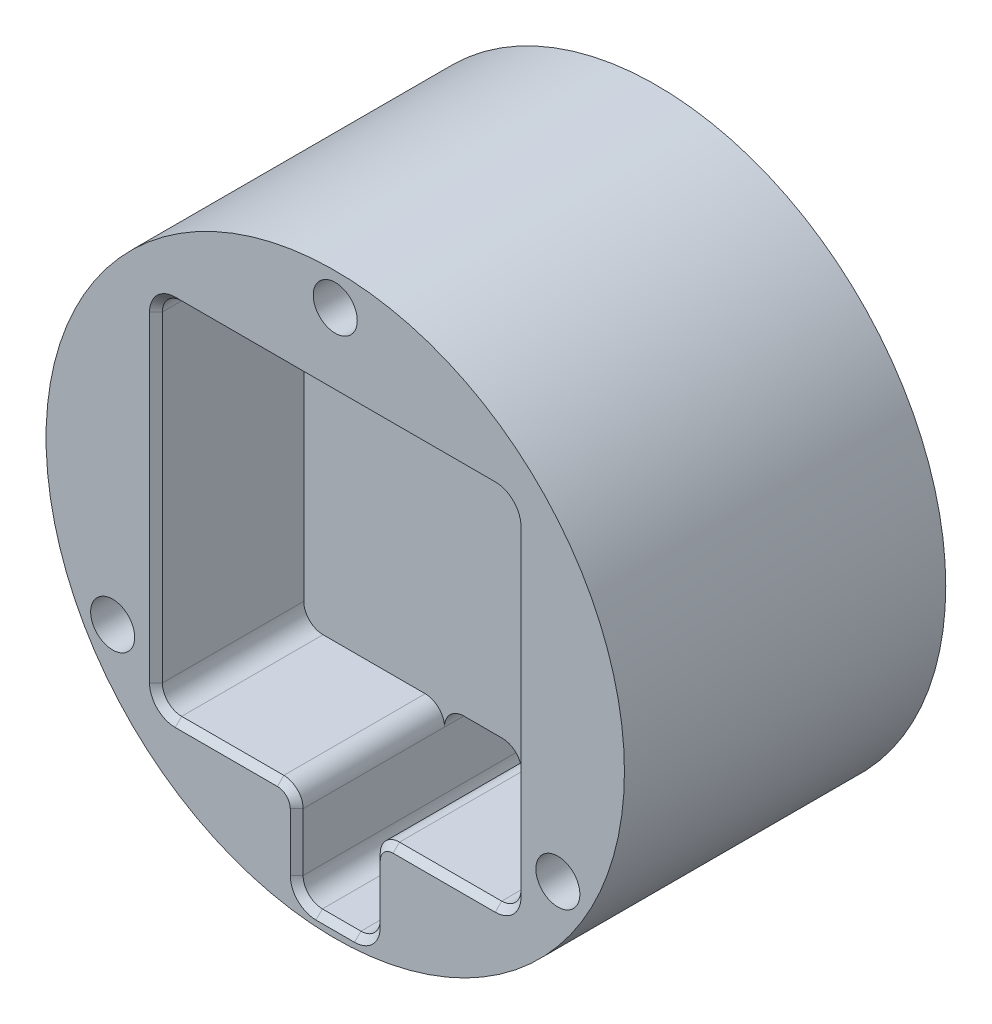
from build123d import *

# Parameters (mm, degrees)
ESQUISSE1_R             = 45
BOSS_EXTRU_1_DEPTH      = 50
ESQUISSE2_W             = 55.8
ESQUISSE2_H             = 56
ENL_V_MAT_EXTRU_1_DEPTH = 23
CONG_1_R                = 3
ESQUISSE3_W             = 12
ESQUISSE3_H             = 15
ENL_V_MAT_EXTRU_2_DEPTH = 81.932070281
CONG_2_R                = 3
CONG_3_R                = 3
CHANFREIN1_SIZE         = 1
ESQUISSE5_R             = 1.6
ENL_V_MAT_EXTRU_3_DEPTH = 81.932070281
ESQUISSE6_R             = 3.425
ESQUISSE6_R_2           = 1.6
ENL_V_MAT_EXTRU_4_DEPTH = 5
ESQUISSE7_R             = 2.6
ESQUISSE7_R_2           = 1.6
ENL_V_MAT_EXTRU_5_DEPTH = 30
CHANFREIN2_SIZE         = 1
ENL_V_START             = -4
ESQUISSE8_R             = 1.925
ESQUISSE8_R_2           = 1.6
ENL_V_MAT_EXTRU_6_DEPTH = 4


with BuildPart() as part:
    # Esquisse1 → Boss.-Extru.1 (new body)
    with BuildSketch(Plane.XY):
        Circle(ESQUISSE1_R)
    extrude(amount=BOSS_EXTRU_1_DEPTH)

    # Esquisse2 → Enlèv. mat.-Extru.1 (cut)
    with BuildSketch(Plane.XY.offset(50)):
        Rectangle(ESQUISSE2_W, ESQUISSE2_H)
    extrude(amount=-ENL_V_MAT_EXTRU_1_DEPTH, mode=Mode.SUBTRACT)

    # Congé1
    cong_1_edges = [part.edges().sort_by_distance(p)[0] for p in [
        (-27.9, -28, 38.5),
        (-27.9, 28, 38.5),
        (27.9, 28, 38.5),
        (27.9, -28, 38.5),
    ]]
    fillet(cong_1_edges, radius=CONG_1_R)

    # Esquisse3 → Enlèv. mat.-Extru.2 (cut, through all)
    with BuildSketch(Plane.XY.offset(50)):
        with Locations((0, -35.5)):
            Rectangle(ESQUISSE3_W, ESQUISSE3_H)
    extrude(amount=-ENL_V_MAT_EXTRU_2_DEPTH, mode=Mode.SUBTRACT)

    # Congé2
    cong_2_edges = [part.edges().sort_by_distance(p)[0] for p in [
        (-6, -28, 38.5),
        (6, -28, 38.5),
        (6, -43, 25),
        (-6, -43, 25),
    ]]
    fillet(cong_2_edges, radius=CONG_2_R)

    # Congé3
    cong_3_edges = [part.edges().sort_by_distance(p)[0] for p in [
        (6, -28, 13.5),
        (-6, -28, 13.5),
    ]]
    fillet(cong_3_edges, radius=CONG_3_R)

    # Chanfrein1
    chanfrein1_edges = [part.edges().sort_by_distance(p)[0] for p in [
        (27.9, 0, 50),
        (-16.95, -28, 50),
        (-27.9, 0, 50),
        (0, 28, 50),
        (27.021320344, -27.121320344, 50),
        (-27.021320344, -27.121320344, 50),
        (-27.021320344, 27.121320344, 50),
        (27.021320344, 27.121320344, 50),
        (16.95, -28, 50),
        (6, -35.5, 50),
        (0, -43, 50),
        (-6, -35.5, 50),
        (-6.878679656, -28.878679656, 50),
        (6.878679656, -28.878679656, 50),
        (5.121320344, -42.121320344, 50),
        (-5.121320344, -42.121320344, 50),
    ]]
    chamfer(chanfrein1_edges, length=CHANFREIN1_SIZE)

    # Esquisse5 → Enlèv. mat.-Extru.3 (cut, through all)
    with BuildSketch(Plane.XY.offset(50)):
        with Locations((-34.641016151, -20)):
            Circle(ESQUISSE5_R)
        with Locations((0, 40)):
            Circle(ESQUISSE5_R)
        with Locations((34.641016151, -20)):
            Circle(ESQUISSE5_R)
    extrude(amount=-ENL_V_MAT_EXTRU_3_DEPTH, mode=Mode.SUBTRACT)

    # Esquisse6 → Enlèv. mat.-Extru.4 (cut)
    # profile 1 of 3: a face of its own
    with BuildSketch(Plane.XY.offset(50)):
        with Locations((-34.641016151, -20)):
            Circle(ESQUISSE6_R)
        with Locations((-34.641016151, -20)):
            Circle(ESQUISSE6_R_2, mode=Mode.SUBTRACT)
    # profile 2 of 3: a face of its own
    with BuildSketch(Plane.XY.offset(50)):
        with Locations((0, 40)):
            Circle(ESQUISSE6_R)
        with Locations((0, 40)):
            Circle(ESQUISSE6_R_2, mode=Mode.SUBTRACT)
    # profile 3 of 3: a face of its own
    with BuildSketch(Plane.XY.offset(50)):
        with Locations((34.641016151, -20)):
            Circle(ESQUISSE6_R)
        with Locations((34.641016151, -20)):
            Circle(ESQUISSE6_R_2, mode=Mode.SUBTRACT)
    extrude(amount=-ENL_V_MAT_EXTRU_4_DEPTH, mode=Mode.SUBTRACT)

    # Esquisse7 → Enlèv. mat.-Extru.5 (cut)
    # profile 1 of 3: a face of its own
    with BuildSketch(Plane.XY.offset(50)):
        with Locations((-34.641016151, -20)):
            Circle(ESQUISSE7_R)
        with Locations((-34.641016151, -20)):
            Circle(ESQUISSE7_R_2, mode=Mode.SUBTRACT)
    # profile 2 of 3: a face of its own
    with BuildSketch(Plane.XY.offset(50)):
        with Locations((0, 40)):
            Circle(ESQUISSE7_R)
        with Locations((0, 40)):
            Circle(ESQUISSE7_R_2, mode=Mode.SUBTRACT)
    # profile 3 of 3: a face of its own
    with BuildSketch(Plane.XY.offset(50)):
        with Locations((34.641016151, -20)):
            Circle(ESQUISSE7_R)
        with Locations((34.641016151, -20)):
            Circle(ESQUISSE7_R_2, mode=Mode.SUBTRACT)
    extrude(amount=-ENL_V_MAT_EXTRU_5_DEPTH, mode=Mode.SUBTRACT)

    # Chanfrein2
    chanfrein2_edges = [part.edges().sort_by_distance(p)[0] for p in [
        (-36.241016151, -20, 20),
        (-1.6, 40, 20),
        (33.041016151, -20, 20),
    ]]
    chamfer(chanfrein2_edges, length=CHANFREIN2_SIZE - 0.0001)  # a hair under: the kernel refuses the full size

    # Esquisse8 → Enlèv. mat.-Extru.6 (cut)
    # profile 1 of 3: a face of its own
    with BuildSketch(Plane(origin=(0, 0, 0), x_dir=(-1, 0, 0), z_dir=(0, 0, -1)).offset(ENL_V_START)):
        with Locations((-34.641016151, -20)):
            Circle(ESQUISSE8_R)
        with Locations(Location((-34.641016151, -20, 0), (0, 0, 180))):
            Circle(ESQUISSE8_R_2, mode=Mode.SUBTRACT)
    # profile 2 of 3: a face of its own
    with BuildSketch(Plane(origin=(0, 0, 0), x_dir=(-1, 0, 0), z_dir=(0, 0, -1)).offset(ENL_V_START)):
        with Locations((0, 40)):
            Circle(ESQUISSE8_R)
        with Locations(Location((0, 40, 0), (0, 0, 180))):
            Circle(ESQUISSE8_R_2, mode=Mode.SUBTRACT)
    # profile 3 of 3: a face of its own
    with BuildSketch(Plane(origin=(0, 0, 0), x_dir=(-1, 0, 0), z_dir=(0, 0, -1)).offset(ENL_V_START)):
        with Locations((34.641016151, -20)):
            Circle(ESQUISSE8_R)
        with Locations(Location((34.641016151, -20, 0), (0, 0, 180))):
            Circle(ESQUISSE8_R_2, mode=Mode.SUBTRACT)
    extrude(amount=ENL_V_MAT_EXTRU_6_DEPTH, mode=Mode.SUBTRACT)


solid = part.part
